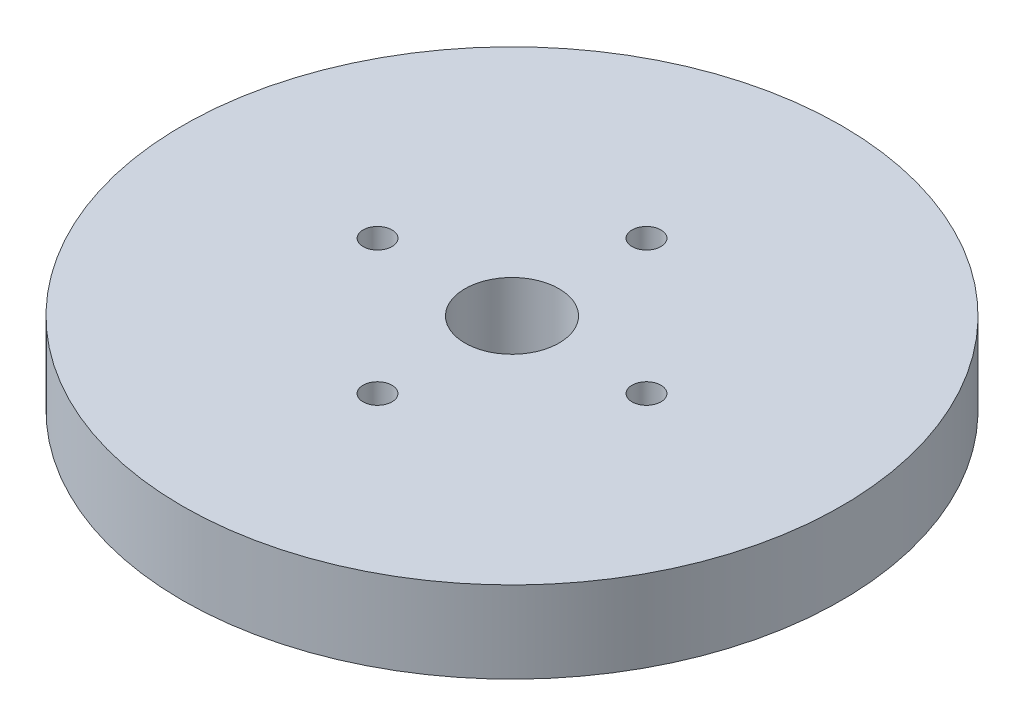
from build123d import *

# Parameters (mm, degrees)
SKETCH1_R           = 52.5
BOSS_EXTRUDE1_DEPTH = 13
SKETCH2_R           = 7.5
CUT_EXTRUDE1_DEPTH  = 76.375725535
SKETCH3_R           = 2.305159733
CUT_EXTRUDE2_DEPTH  = 8.842975373
CIRPATTERN1_COUNT   = 4


with BuildPart() as part:
    # Sketch1 → Boss-Extrude1 (new body)
    with BuildSketch(Plane(origin=(0, 0, 0), x_dir=(1, 0, 0), z_dir=(0, 1, 0))):
        Circle(SKETCH1_R)
    extrude(amount=BOSS_EXTRUDE1_DEPTH)

    # Sketch2 → Cut-Extrude1 (cut, through all)
    with BuildSketch(Plane(origin=(0, 0, 0), x_dir=(1, 0, 0), z_dir=(0, 1, 0))):
        Circle(SKETCH2_R)
    extrude(amount=CUT_EXTRUDE1_DEPTH, mode=Mode.SUBTRACT)

    # Sketch3 → Cut-Extrude2 (cut)
    with BuildSketch(Plane(origin=(0, 13, 0), x_dir=(1, 0, 0), z_dir=(0, 1, 0))):
        with Locations((-21.422945149, 0)):
            Circle(SKETCH3_R)
    cut_extrude2 = extrude(amount=-CUT_EXTRUDE2_DEPTH, mode=Mode.SUBTRACT)

    # CirPattern1: Cut-Extrude2 ×4 about axis
    cirpattern1_axis = Axis((0, 0, 0), (0, 1, 0))
    for i in range(1, CIRPATTERN1_COUNT):
        add(cut_extrude2.rotate(cirpattern1_axis, i * 360 / CIRPATTERN1_COUNT), mode=Mode.SUBTRACT)


solid = part.part
